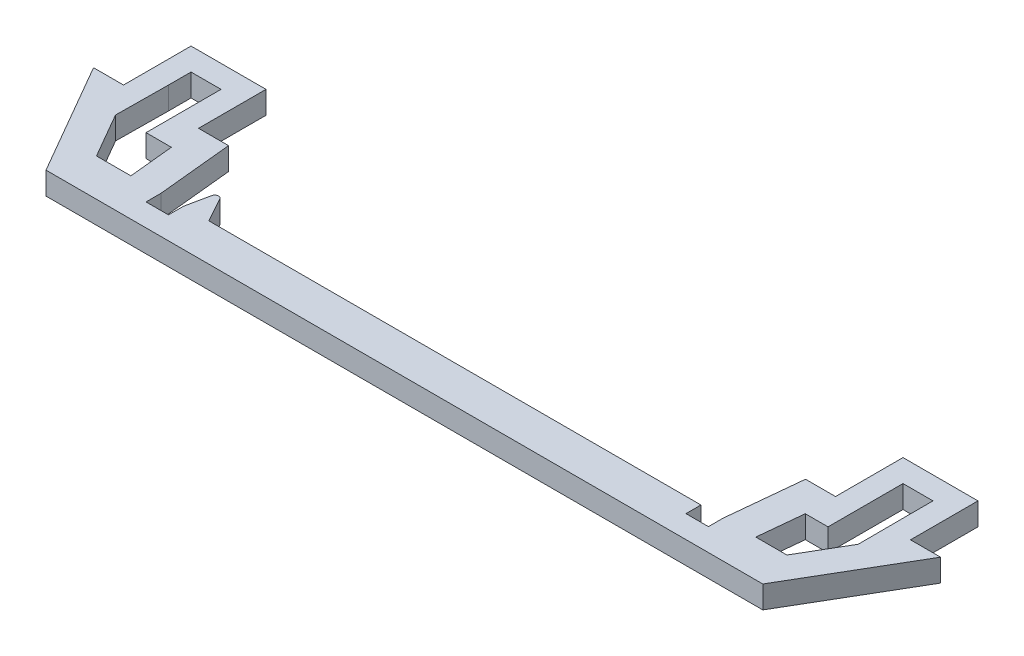
from build123d import *

# Parameters (mm, degrees)
BOSS_EXTRUDE1_DEPTH = 3


with BuildPart() as part:
    # Sketch1 → Boss-Extrude1 (new body)
    with BuildSketch(Plane(origin=(0, 0, 0), x_dir=(1, 0, 0), z_dir=(0, 1, 0))):
        with BuildLine():
            Line((-62.418566214, -47.1586621), (-58.418566214, -47.1586621))
            Line((-58.418566214, -47.1586621), (-58.418566214, -38.1586621))
            Line((-58.418566214, -38.1586621), (-48.418566214, -38.1586621))
            Line((-48.418566214, -38.1586621), (-48.418566214, -47.1586621))
            Line((-48.418566214, -47.1586621), (-44.418566214, -47.1586621))
            Line((-44.418566214, -47.1586621), (-43.418817081, -57.156153425))
            Line((-43.418817081, -57.156153425), (-43.418817081, -59.1586621))
            Line((-43.418817081, -59.1586621), (-40.418817081, -59.1586621))
            Line((-40.418817081, -59.1586621), (-40.418817081, -57.1586621))
            Line((-40.418817081, -57.1586621), (-39.768314985, -54.040900504))
            ThreePointArc((-39.768314985, -54.040900504), (-39.353561489, -53.648635874), (-38.841423204, -53.900838924))
            Line((-38.841423204, -53.900838924), (-37.03772781, -57.1586621))
            Line((-37.03772781, -57.1586621), (28.581433786, -57.1586621))
            Line((28.581433786, -57.1586621), (28.581433786, -59.1586621))
            Line((28.581433786, -59.1586621), (31.581433786, -59.1586621))
            Line((31.581433786, -59.1586621), (31.581433786, -57.208800497))
            Line((31.581433786, -57.208800497), (32.581433786, -47.211334262))
            Line((32.581433786, -47.211334262), (36.581433786, -47.211334262))
            Line((36.581433786, -47.211334262), (36.581433786, -38.211334262))
            Line((36.581433786, -38.211334262), (46.581433786, -38.211334262))
            Line((46.581433786, -38.211334262), (46.581433786, -47.211334262))
            Line((46.581433786, -47.211334262), (50.581433786, -47.211334262))
            Line((50.581433786, -47.211334262), (41.830582941, -62.1586621))
            Line((41.830582941, -62.1586621), (-53.758312176, -62.1586621))
            Line((-53.758312176, -62.1586621), (-62.418566214, -47.1586621))
        make_face()
        Polygon((36.547763078, -51.211334262), (39.581433786, -51.211334262), (39.581433786, -44.211334262), (39.581433786, -41.211334262), (43.581433786, -41.211334262), (43.581433786, -44.211334262), (43.604572315, -51.211334262), (40.093380681, -57.208800497), (35.947864455, -57.208800497), align=None, mode=Mode.SUBTRACT)
        Polygon((-55.418566214, -41.1586621), (-51.418566214, -41.1586621), (-51.418566214, -44.1586621), (-51.418566214, -51.1586621), (-48.038516462, -51.1586621), (-47.438516462, -57.1586621), (-52.026261368, -57.1586621), (-55.490362984, -51.1586621), (-55.418566214, -44.1586621), align=None, mode=Mode.SUBTRACT)
    extrude(amount=BOSS_EXTRUDE1_DEPTH)


solid = part.part
